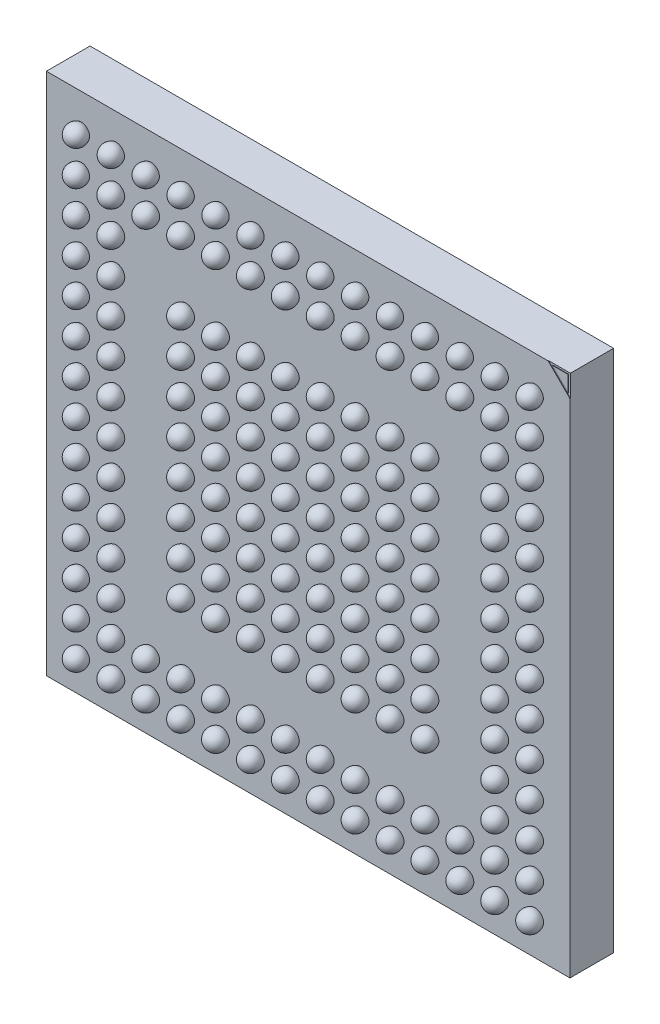
from build123d import *

# Parameters (mm, degrees)
SKETCH1_W            = 12
SKETCH1_H            = 12
BOSS_EXTRUDE1_DEPTH  = 1
LPATTERN1_COUNT      = 14
LPATTERN1_PITCH      = 0.8
LPATTERN2_COUNT      = 14
LPATTERN2_PITCH      = 0.8
LPATTERN3_COUNT      = 12
LPATTERN3_PITCH      = 0.8
LPATTERN4_COUNT      = 13
LPATTERN4_PITCH      = 0.8
LPATTERN5_COUNT      = 12
LPATTERN5_PITCH      = 0.8
LPATTERN6_COUNT      = 11
LPATTERN6_PITCH      = 0.8
LPATTERN7_COUNT      = 8
LPATTERN7_PITCH      = 0.8
LPATTERN7_COUNT_DIR2 = 8
LPATTERN7_PITCH_DIR2 = 0.8
BOSS_EXTRUDE2_DEPTH  = 0.01
BOSS_EXTRUDE3_DEPTH  = 0.01
CUT_EXTRUDE1_DEPTH   = 0.01
BOSS_EXTRUDE4_DEPTH  = 0.01


with BuildPart() as part:
    # Sketch1 → Boss-Extrude1 (new body)
    with BuildSketch(Plane.XY):
        Rectangle(SKETCH1_W, SKETCH1_H)
    extrude(amount=BOSS_EXTRUDE1_DEPTH)

    # Sketch3 → Revolve1 (revolve)
    with BuildSketch(Plane.XY.offset(1.12)):
        with BuildLine():
            Line((-5.2, 5.425), (-5.2, 4.975))
            ThreePointArc((-5.2, 4.975), (-5.425, 5.2), (-5.2, 5.425))
        make_face()
    revolve1 = revolve(axis=Axis((-5.2, 5.425, 1.12), (0, -1, 0)))

    # LPattern1: Revolve1 ×14
    with Locations(*[(i * LPATTERN1_PITCH, 0, 0) for i in range(1, LPATTERN1_COUNT)]):
        add(revolve1)

    # LPattern2: Revolve1 ×14
    with Locations(*[(0, -i * LPATTERN2_PITCH, 0) for i in range(1, LPATTERN2_COUNT)]):
        add(revolve1)

    # Sketch5 → Revolve2 (revolve)
    with BuildSketch(Plane.XY.offset(1.12)):
        with BuildLine():
            Line((5.2, 4.63), (5.2, 4.17))
            ThreePointArc((5.2, 4.17), (4.97, 4.4), (5.2, 4.63))
        make_face()
    revolve2 = revolve(axis=Axis((5.2, 5.2, 1.12), (0, -1, 0)))

    # LPattern3: Revolve2 ×12
    with Locations(*[(0, -i * LPATTERN3_PITCH, 0) for i in range(1, LPATTERN3_COUNT)]):
        add(revolve2)

    # Sketch8 → Revolve3 (revolve)
    with BuildSketch(Plane.XY.offset(1.12)):
        with BuildLine():
            Line((5.2, -4.972556486), (5.2, -5.432556486))
            ThreePointArc((5.2, -5.432556486), (5.43, -5.202556486), (5.2, -4.972556486))
        make_face()
    revolve3 = revolve(axis=Axis((5.2, -4.972556486, 1.12), (0, -1, 0)))

    # LPattern4: Revolve3 ×13
    with Locations(*[(-i * LPATTERN4_PITCH, 0, 0) for i in range(1, LPATTERN4_COUNT)]):
        add(revolve3)

    # Sketch9 → Revolve4 (revolve)
    with BuildSketch(Plane.XY.offset(1.12)):
        with BuildLine():
            Line((-4.4, 4.63), (-4.4, 4.17))
            ThreePointArc((-4.4, 4.17), (-4.17, 4.4), (-4.4, 4.63))
        make_face()
    revolve4 = revolve(axis=Axis((-4.4, 4.63, 1.12), (0, -1, 0)))

    # LPattern5: Revolve4 ×12
    with Locations(*[(i * LPATTERN5_PITCH, 0, 0) for i in range(1, LPATTERN5_COUNT)]):
        add(revolve4)

    # Mirror3: Revolve4 across plane
    add(revolve4.mirror(Plane.ZX))

    # Mirror3 copy 1 sketch → Mirror3 copy 1 (revolve)
    with BuildSketch(Plane(origin=(0.8, 0, 1.12), x_dir=(1, 0, 0), z_dir=(0, 0, 1))):
        with BuildLine():
            Line((-4.4, -4.63), (-4.4, -4.17))
            ThreePointArc((-4.4, -4.17), (-4.17, -4.4), (-4.4, -4.63))
        make_face()
    revolve(axis=Axis((-3.6, -4.63, 1.12), (0, -1, 0)))

    # Mirror3 copy 2 sketch → Mirror3 copy 2 (revolve)
    with BuildSketch(Plane(origin=(1.6, 0, 1.12), x_dir=(1, 0, 0), z_dir=(0, 0, 1))):
        with BuildLine():
            Line((-4.4, -4.63), (-4.4, -4.17))
            ThreePointArc((-4.4, -4.17), (-4.17, -4.4), (-4.4, -4.63))
        make_face()
    revolve(axis=Axis((-2.8, -4.63, 1.12), (0, -1, 0)))

    # Mirror3 copy 3 sketch → Mirror3 copy 3 (revolve)
    with BuildSketch(Plane(origin=(2.4, 0, 1.12), x_dir=(1, 0, 0), z_dir=(0, 0, 1))):
        with BuildLine():
            Line((-4.4, -4.63), (-4.4, -4.17))
            ThreePointArc((-4.4, -4.17), (-4.17, -4.4), (-4.4, -4.63))
        make_face()
    revolve(axis=Axis((-2, -4.63, 1.12), (0, -1, 0)))

    # Mirror3 copy 4 sketch → Mirror3 copy 4 (revolve)
    with BuildSketch(Plane(origin=(3.2, 0, 1.12), x_dir=(1, 0, 0), z_dir=(0, 0, 1))):
        with BuildLine():
            Line((-4.4, -4.63), (-4.4, -4.17))
            ThreePointArc((-4.4, -4.17), (-4.17, -4.4), (-4.4, -4.63))
        make_face()
    revolve(axis=Axis((-1.2, -4.63, 1.12), (0, -1, 0)))

    # Mirror3 copy 5 sketch → Mirror3 copy 5 (revolve)
    with BuildSketch(Plane(origin=(4, 0, 1.12), x_dir=(1, 0, 0), z_dir=(0, 0, 1))):
        with BuildLine():
            Line((-4.4, -4.63), (-4.4, -4.17))
            ThreePointArc((-4.4, -4.17), (-4.17, -4.4), (-4.4, -4.63))
        make_face()
    revolve(axis=Axis((-0.4, -4.63, 1.12), (0, -1, 0)))

    # Mirror3 copy 6 sketch → Mirror3 copy 6 (revolve)
    with BuildSketch(Plane(origin=(4.8, 0, 1.12), x_dir=(1, 0, 0), z_dir=(0, 0, 1))):
        with BuildLine():
            Line((-4.4, -4.63), (-4.4, -4.17))
            ThreePointArc((-4.4, -4.17), (-4.17, -4.4), (-4.4, -4.63))
        make_face()
    revolve(axis=Axis((0.4, -4.63, 1.12), (0, -1, 0)))

    # Mirror3 copy 7 sketch → Mirror3 copy 7 (revolve)
    with BuildSketch(Plane(origin=(5.6, 0, 1.12), x_dir=(1, 0, 0), z_dir=(0, 0, 1))):
        with BuildLine():
            Line((-4.4, -4.63), (-4.4, -4.17))
            ThreePointArc((-4.4, -4.17), (-4.17, -4.4), (-4.4, -4.63))
        make_face()
    revolve(axis=Axis((1.2, -4.63, 1.12), (0, -1, 0)))

    # Mirror3 copy 8 sketch → Mirror3 copy 8 (revolve)
    with BuildSketch(Plane(origin=(6.4, 0, 1.12), x_dir=(1, 0, 0), z_dir=(0, 0, 1))):
        with BuildLine():
            Line((-4.4, -4.63), (-4.4, -4.17))
            ThreePointArc((-4.4, -4.17), (-4.17, -4.4), (-4.4, -4.63))
        make_face()
    revolve(axis=Axis((2, -4.63, 1.12), (0, -1, 0)))

    # Mirror3 copy 9 sketch → Mirror3 copy 9 (revolve)
    with BuildSketch(Plane(origin=(7.2, 0, 1.12), x_dir=(1, 0, 0), z_dir=(0, 0, 1))):
        with BuildLine():
            Line((-4.4, -4.63), (-4.4, -4.17))
            ThreePointArc((-4.4, -4.17), (-4.17, -4.4), (-4.4, -4.63))
        make_face()
    revolve(axis=Axis((2.8, -4.63, 1.12), (0, -1, 0)))

    # Mirror3 copy 10 sketch → Mirror3 copy 10 (revolve)
    with BuildSketch(Plane(origin=(8, 0, 1.12), x_dir=(1, 0, 0), z_dir=(0, 0, 1))):
        with BuildLine():
            Line((-4.4, -4.63), (-4.4, -4.17))
            ThreePointArc((-4.4, -4.17), (-4.17, -4.4), (-4.4, -4.63))
        make_face()
    revolve(axis=Axis((3.6, -4.63, 1.12), (0, -1, 0)))

    # Mirror3 copy 11 sketch → Mirror3 copy 11 (revolve)
    with BuildSketch(Plane(origin=(8.8, 0, 1.12), x_dir=(1, 0, 0), z_dir=(0, 0, 1))):
        with BuildLine():
            Line((-4.4, -4.63), (-4.4, -4.17))
            ThreePointArc((-4.4, -4.17), (-4.17, -4.4), (-4.4, -4.63))
        make_face()
    revolve(axis=Axis((4.4, -4.63, 1.12), (0, -1, 0)))

    # LPattern6: Revolve4 ×11
    with Locations(*[(0, -i * LPATTERN6_PITCH, 0) for i in range(1, LPATTERN6_COUNT)]):
        add(revolve4)

    # Mirror4 copy 1 sketch → Mirror4 copy 1 (revolve)
    with BuildSketch(Plane(origin=(0, -0.8, 1.12), x_dir=(-1, 0, 0), z_dir=(0, 0, 1))):
        with BuildLine():
            Line((-4.4, -4.63), (-4.4, -4.17))
            ThreePointArc((-4.4, -4.17), (-4.17, -4.4), (-4.4, -4.63))
        make_face()
    revolve(axis=Axis((4.4, 3.83, 1.12), (0, 1, 0)))

    # Mirror4 copy 2 sketch → Mirror4 copy 2 (revolve)
    with BuildSketch(Plane(origin=(0, -1.6, 1.12), x_dir=(-1, 0, 0), z_dir=(0, 0, 1))):
        with BuildLine():
            Line((-4.4, -4.63), (-4.4, -4.17))
            ThreePointArc((-4.4, -4.17), (-4.17, -4.4), (-4.4, -4.63))
        make_face()
    revolve(axis=Axis((4.4, 3.03, 1.12), (0, 1, 0)))

    # Mirror4 copy 3 sketch → Mirror4 copy 3 (revolve)
    with BuildSketch(Plane(origin=(0, -2.4, 1.12), x_dir=(-1, 0, 0), z_dir=(0, 0, 1))):
        with BuildLine():
            Line((-4.4, -4.63), (-4.4, -4.17))
            ThreePointArc((-4.4, -4.17), (-4.17, -4.4), (-4.4, -4.63))
        make_face()
    revolve(axis=Axis((4.4, 2.23, 1.12), (0, 1, 0)))

    # Mirror4 copy 4 sketch → Mirror4 copy 4 (revolve)
    with BuildSketch(Plane(origin=(0, -3.2, 1.12), x_dir=(-1, 0, 0), z_dir=(0, 0, 1))):
        with BuildLine():
            Line((-4.4, -4.63), (-4.4, -4.17))
            ThreePointArc((-4.4, -4.17), (-4.17, -4.4), (-4.4, -4.63))
        make_face()
    revolve(axis=Axis((4.4, 1.43, 1.12), (0, 1, 0)))

    # Mirror4 copy 5 sketch → Mirror4 copy 5 (revolve)
    with BuildSketch(Plane(origin=(0, -4, 1.12), x_dir=(-1, 0, 0), z_dir=(0, 0, 1))):
        with BuildLine():
            Line((-4.4, -4.63), (-4.4, -4.17))
            ThreePointArc((-4.4, -4.17), (-4.17, -4.4), (-4.4, -4.63))
        make_face()
    revolve(axis=Axis((4.4, 0.63, 1.12), (0, 1, 0)))

    # Mirror4 copy 6 sketch → Mirror4 copy 6 (revolve)
    with BuildSketch(Plane(origin=(0, -4.8, 1.12), x_dir=(-1, 0, 0), z_dir=(0, 0, 1))):
        with BuildLine():
            Line((-4.4, -4.63), (-4.4, -4.17))
            ThreePointArc((-4.4, -4.17), (-4.17, -4.4), (-4.4, -4.63))
        make_face()
    revolve(axis=Axis((4.4, -0.17, 1.12), (0, 1, 0)))

    # Mirror4 copy 7 sketch → Mirror4 copy 7 (revolve)
    with BuildSketch(Plane(origin=(0, -5.6, 1.12), x_dir=(-1, 0, 0), z_dir=(0, 0, 1))):
        with BuildLine():
            Line((-4.4, -4.63), (-4.4, -4.17))
            ThreePointArc((-4.4, -4.17), (-4.17, -4.4), (-4.4, -4.63))
        make_face()
    revolve(axis=Axis((4.4, -0.97, 1.12), (0, 1, 0)))

    # Mirror4 copy 8 sketch → Mirror4 copy 8 (revolve)
    with BuildSketch(Plane(origin=(0, -6.4, 1.12), x_dir=(-1, 0, 0), z_dir=(0, 0, 1))):
        with BuildLine():
            Line((-4.4, -4.63), (-4.4, -4.17))
            ThreePointArc((-4.4, -4.17), (-4.17, -4.4), (-4.4, -4.63))
        make_face()
    revolve(axis=Axis((4.4, -1.77, 1.12), (0, 1, 0)))

    # Mirror4 copy 9 sketch → Mirror4 copy 9 (revolve)
    with BuildSketch(Plane(origin=(0, -7.2, 1.12), x_dir=(-1, 0, 0), z_dir=(0, 0, 1))):
        with BuildLine():
            Line((-4.4, -4.63), (-4.4, -4.17))
            ThreePointArc((-4.4, -4.17), (-4.17, -4.4), (-4.4, -4.63))
        make_face()
    revolve(axis=Axis((4.4, -2.57, 1.12), (0, 1, 0)))

    # Mirror4 copy 10 sketch → Mirror4 copy 10 (revolve)
    with BuildSketch(Plane(origin=(0, -8, 1.12), x_dir=(-1, 0, 0), z_dir=(0, 0, 1))):
        with BuildLine():
            Line((-4.4, -4.63), (-4.4, -4.17))
            ThreePointArc((-4.4, -4.17), (-4.17, -4.4), (-4.4, -4.63))
        make_face()
    revolve(axis=Axis((4.4, -3.37, 1.12), (0, 1, 0)))

    # Mirror4 copy 11 sketch → Mirror4 copy 11 (revolve)
    with BuildSketch(Plane(origin=(0, 0, 1.12), x_dir=(-1, 0, 0), z_dir=(0, 0, 1))):
        with BuildLine():
            Line((-4.4, -4.63), (-4.4, -4.17))
            ThreePointArc((-4.4, -4.17), (-4.17, -4.4), (-4.4, -4.63))
        make_face()
    revolve(axis=Axis((4.4, 4.63, 1.12), (0, 1, 0)))

    # Sketch10 → Revolve5 (revolve)
    with BuildSketch(Plane.XY.offset(1.12)):
        with BuildLine():
            Line((-2.8, 3.03), (-2.8, 2.57))
            ThreePointArc((-2.8, 2.57), (-3.03, 2.8), (-2.8, 3.03))
        make_face()
    revolve5 = revolve(axis=Axis((-2.8, 3.03, 1.12), (0, -1, 0)))

    # LPattern7: Revolve5 8 × 8
    with Locations(*[(i * LPATTERN7_PITCH, -j * LPATTERN7_PITCH_DIR2, 0) for i in range(LPATTERN7_COUNT) for j in range(LPATTERN7_COUNT_DIR2) if (i, j) != (0, 0)]):
        add(revolve5)

    # Sketch11 → Boss-Extrude2 (add)
    # profile 1 of 2: a face of its own
    with BuildSketch(Plane(origin=(0, 0, 0), x_dir=(-1, 0, 0), z_dir=(0, 0, -1))):
        with BuildLine():
            Line((-4.383850212, 0.87976633), (-4.383850212, 4.310264847))
            Line((-4.383850212, 4.310264847), (-3.29335538, 4.310264847))
            Line((-3.29335538, 4.310264847), (-1.699193609, 2.507481058))
            Line((-1.699193609, 2.507481058), (-1.699193609, 4.310264847))
            Line((-1.699193609, 4.310264847), (-0.340536036, 4.310264847))
            Line((-0.340536036, 4.310264847), (0.283707933, 3.303879896))
            Line((0.283707933, 3.303879896), (0.905288203, 4.310264847))
            Line((0.905288203, 4.310264847), (3.996249009, 4.310264847))
            ThreePointArc((3.996249009, 4.310264847), (4.420513078, 4.134528915), (4.596249009, 3.710264847))
            Line((4.596249009, 3.710264847), (4.596249009, 2.778053424))
            ThreePointArc((4.596249009, 2.778053424), (4.420513078, 2.353789355), (3.996249009, 2.178053424))
            Line((3.996249009, 2.178053424), (2.328850088, 2.178053424))
            Line((2.328850088, 2.178053424), (2.328850088, 0.844626446))
            Line((2.328850088, 0.844626446), (0.905288203, 0.844626446))
            Line((0.905288203, 0.844626446), (0.283707933, 1.846717072))
            Line((0.283707933, 1.846717072), (-0.324294808, 0.862315154))
            Line((-0.324294808, 0.862315154), (-1.585887652, 0.862315154))
            Line((-1.585887652, 0.862315154), (-3.219751476, 2.709996656))
            Line((-3.219751476, 2.709996656), (-3.219751476, 0.87976633))
            Line((-3.219751476, 0.87976633), (-4.383850212, 0.87976633))
        make_face()
        Polygon((-4.219704391, 1.045144765), (-4.219704391, 4.114773531), (-3.322697893, 4.114773531), (-1.495738313, 1.992381752), (-1.495738313, 3.900233946), (-0.680566666, 2.594058204), (-1.59427424, 1.073528346), (-3.375117038, 3.142345934), (-3.375117038, 1.045144765), align=None, mode=Mode.SUBTRACT)
        Polygon((-1.445224228, 4.150363705), (-0.430793897, 4.150363705), (0.294524128, 2.989356236), (0.990555559, 4.150363705), (2.003154175, 4.150363705), (1.060414542, 2.577837373), (2.035310731, 1.017333266), (1.029352181, 1.017333266), (0.294524128, 2.193563318), (-0.404596433, 1.027403062), (-1.445224228, 1.027403062), (-0.458796817, 2.594058204), align=None, mode=Mode.SUBTRACT)
        with BuildLine():
            Line((2.21981642, 4.150363705), (3.859234326, 4.127386313))
            ThreePointArc((3.859234326, 4.127386313), (4.280993931, 3.945721917), (4.450766882, 3.519036714))
            Line((4.450766882, 3.519036714), (4.442189322, 2.907034951))
            ThreePointArc((4.442189322, 2.907034951), (4.263528963, 2.488216886), (3.842248245, 2.315443472))
            Line((3.842248245, 2.315443472), (2.152608039, 2.315443472))
            Line((2.152608039, 2.315443472), (2.152608039, 1.109618447))
            Line((2.152608039, 1.109618447), (1.267354651, 2.577837373))
            Line((1.267354651, 2.577837373), (2.21981642, 4.150363705))
        make_face(mode=Mode.SUBTRACT)
    # profile 2 of 2: a face of its own
    with BuildSketch(Plane(origin=(0, 0, 0), x_dir=(-1, 0, 0), z_dir=(0, 0, -1))):
        with BuildLine():
            Line((2.152608039, 3.693985443), (3.707065203, 3.693985443))
            ThreePointArc((3.707065203, 3.693985443), (3.848486559, 3.635406799), (3.907065203, 3.493985443))
            Line((3.907065203, 3.493985443), (3.907065203, 2.978053424))
            ThreePointArc((3.907065203, 2.978053424), (3.848486559, 2.836632068), (3.707065203, 2.778053424))
            Line((3.707065203, 2.778053424), (2.152608039, 2.778053424))
            Line((2.152608039, 2.778053424), (2.152608039, 3.693985443))
        make_face()
        with BuildLine():
            Line((2.313280362, 3.527993081), (3.520235623, 3.527993081))
            ThreePointArc((3.520235623, 3.527993081), (3.661656979, 3.469414438), (3.720235623, 3.327993081))
            Line((3.720235623, 3.327993081), (3.720235623, 3.154921786))
            ThreePointArc((3.720235623, 3.154921786), (3.661656979, 3.01350043), (3.520235623, 2.954921786))
            Line((3.520235623, 2.954921786), (2.313280362, 2.954921786))
            Line((2.313280362, 2.954921786), (2.313280362, 3.527993081))
        make_face(mode=Mode.SUBTRACT)
    extrude(amount=BOSS_EXTRUDE2_DEPTH)

    # Sketch12 → Boss-Extrude3 (add)
    # profile 1 of 7: a face of its own
    with BuildSketch(Plane(origin=(0, 0, 0), x_dir=(-1, 0, 0), z_dir=(0, 0, -1))):
        with BuildLine():
            Line((-2.389935631, -3.291769219), (-2.550993323, -3.439124989))
            add(Edge.make_bspline(
                [(-2.550993323, -3.439124989), (-2.557892344, -3.429393202), (-2.571137502, -3.41070953), (-2.592606522, -3.385691652), (-2.613978598, -3.36434954), (-2.63545173, -3.346772353), (-2.657216247, -3.333066883), (-2.679234369, -3.323363259), (-2.70138127, -3.317194573), (-2.716260569, -3.316426423), (-2.723589477, -3.316048066)],
                knots=[0, 0, 0, 0, 1.299362458, 2.494594718, 3.587462134, 4.587049575, 5.512617175, 6.380583204, 7.202344345, 8, 8, 8, 8], degree=3))
            add(Edge.make_bspline(
                [(-2.723589477, -3.316048066), (-2.730425672, -3.31628781), (-2.743624569, -3.316750695), (-2.762440575, -3.321351731), (-2.779145694, -3.329292444), (-2.793723621, -3.339675594), (-2.80527149, -3.352184882), (-2.814491568, -3.36530391), (-2.819683247, -3.379784349), (-2.820366574, -3.389730099), (-2.820704861, -3.394653835)],
                knots=[0, 0, 0, 0, 1.185010067, 2.2879431, 3.333075148, 4.379039566, 5.372662701, 6.27520591, 7.14612461, 8, 8, 8, 8], degree=3))
            add(Edge.make_bspline(
                [(-2.820704861, -3.394653835), (-2.820492874, -3.399648573), (-2.82006596, -3.409707283), (-2.815942557, -3.424449574), (-2.80972741, -3.438854509), (-2.803788584, -3.447623478), (-2.800752938, -3.452105758)],
                knots=[0, 0, 0, 0, 0.967525499, 1.948461899, 2.951351359, 4, 4, 4, 4], degree=3))
            add(Edge.make_bspline(
                [(-2.800752938, -3.452105758), (-2.797993208, -3.455589787), (-2.791640674, -3.463609562), (-2.779527693, -3.476311635), (-2.764316332, -3.491872787), (-2.745421227, -3.509757915), (-2.723626765, -3.530610238), (-2.697922745, -3.553610043), (-2.66904904, -3.579469608), (-2.64852628, -3.597477272), (-2.637772169, -3.60691345)],
                knots=[0, 0, 0, 0, 0.473873513, 1.090794244, 1.870441696, 2.795289791, 3.865433203, 5.087734844, 6.473946851, 8, 8, 8, 8], degree=3))
            add(Edge.make_bspline(
                [(-2.637772169, -3.60691345), (-2.627677889, -3.61564954), (-2.608521042, -3.632228825), (-2.581264654, -3.655760457), (-2.557310828, -3.676931293), (-2.536310612, -3.695423603), (-2.518582349, -3.711431415), (-2.504051508, -3.725031245), (-2.492540622, -3.73595833), (-2.485997356, -3.742558295), (-2.483204861, -3.745374989)],
                knots=[0, 0, 0, 0, 1.543621617, 2.929473131, 4.163658386, 5.240097082, 6.164993805, 6.925417477, 7.541396219, 8, 8, 8, 8], degree=3))
            add(Edge.make_bspline(
                [(-2.483204861, -3.745374989), (-2.472610718, -3.756840121), (-2.452245054, -3.778880131), (-2.425776871, -3.813035214), (-2.4039927, -3.846377541), (-2.387140052, -3.879534499), (-2.374412254, -3.912984479), (-2.365438988, -3.947547839), (-2.360064839, -3.983585745), (-2.359468183, -4.008177216), (-2.3591664, -4.020615373)],
                knots=[0, 0, 0, 0, 1.206664779, 2.319633467, 3.337109185, 4.282041471, 5.190008762, 6.099243693, 7.03861361, 8, 8, 8, 8], degree=3))
            add(Edge.make_bspline(
                [(-2.3591664, -4.020615373), (-2.359381202, -4.032734832), (-2.359802651, -4.056513661), (-2.364964594, -4.091310436), (-2.372325222, -4.124612459), (-2.383706044, -4.156057358), (-2.397576923, -4.186161292), (-2.414966073, -4.214455336), (-2.435387245, -4.241225838), (-2.458793044, -4.265994243), (-2.484682636, -4.288469853), (-2.512451685, -4.308478172), (-2.542371729, -4.324997588), (-2.574187137, -4.338600149), (-2.607880878, -4.349077024), (-2.643412814, -4.35682041), (-2.680837292, -4.361467869), (-2.706428689, -4.361953705), (-2.719502938, -4.362201912)],
                knots=[0, 0, 0, 0, 1.043214005, 2.046824704, 3.02475056, 3.976699089, 4.921714032, 5.875962561, 6.831408892, 7.817874052, 8.806269674, 9.781291748, 10.760897367, 11.74438705, 12.757449933, 13.795994037, 14.874007457, 16, 16, 16, 16], degree=3))
            add(Edge.make_bspline(
                [(-2.719502938, -4.362201912), (-2.729766112, -4.362019836), (-2.750093083, -4.361659222), (-2.780051965, -4.358715109), (-2.808980652, -4.353963624), (-2.836846558, -4.347153326), (-2.863775225, -4.338523754), (-2.889767759, -4.327983064), (-2.914644724, -4.315367877), (-2.938594351, -4.300937612), (-2.961500215, -4.284182174), (-2.983651953, -4.265444122), (-3.004829532, -4.244435257), (-3.025134663, -4.221205263), (-3.044437429, -4.195688359), (-3.063369679, -4.168239914), (-3.081090006, -4.138350524), (-3.092036641, -4.117382875), (-3.097627938, -4.106673066)],
                knots=[0, 0, 0, 0, 1.016823716, 2.013894106, 2.979844003, 3.91962641, 4.853723003, 5.779685073, 6.695824784, 7.614987388, 8.547259901, 9.504950863, 10.487499108, 11.500346958, 12.559593716, 13.656357062, 14.802919212, 16, 16, 16, 16], degree=3))
            Line((-3.097627938, -4.106673066), (-2.908204861, -3.992971142))
            add(Edge.make_bspline(
                [(-2.908204861, -3.992971142), (-2.901210984, -4.005128176), (-2.887803122, -4.028434248), (-2.865082247, -4.059748909), (-2.84180587, -4.086564733), (-2.817435863, -4.108407748), (-2.792268555, -4.125570024), (-2.766182384, -4.137835376), (-2.73915902, -4.145427616), (-2.720751932, -4.146354803), (-2.711570246, -4.146817296)],
                knots=[0, 0, 0, 0, 1.283663364, 2.460892379, 3.537111102, 4.529833553, 5.449777664, 6.316464042, 7.160231139, 8, 8, 8, 8], degree=3))
            add(Edge.make_bspline(
                [(-2.711570246, -4.146817296), (-2.702231157, -4.1464396), (-2.684111963, -4.145706813), (-2.658249132, -4.138938282), (-2.63453711, -4.128311193), (-2.614040613, -4.113147802), (-2.596685472, -4.095646944), (-2.583876382, -4.076176439), (-2.575829625, -4.055109823), (-2.574978887, -4.040475566), (-2.574551015, -4.033115373)],
                knots=[0, 0, 0, 0, 1.13588714, 2.203786484, 3.234766741, 4.283437687, 5.291419208, 6.222934724, 7.106237994, 8, 8, 8, 8], degree=3))
            add(Edge.make_bspline(
                [(-2.574551015, -4.033115373), (-2.574946138, -4.026267912), (-2.575748791, -4.012357949), (-2.581660888, -3.991676071), (-2.590903299, -3.971003598), (-2.601837722, -3.954047477), (-2.612964867, -3.939850576), (-2.623604928, -3.927549604), (-2.636561707, -3.913959183), (-2.651802352, -3.899062218), (-2.669125494, -3.882727567), (-2.688545726, -3.86495683), (-2.710285429, -3.845906545), (-2.725651095, -3.832929679), (-2.733685631, -3.826144219)],
                knots=[0, 0, 0, 0, 0.916159276, 1.861089862, 2.860218735, 3.940849679, 4.552606315, 5.27541173, 6.11797699, 7.06649574, 8.129236253, 9.306560635, 10.591630461, 12, 12, 12, 12], degree=3))
            add(Edge.make_bspline(
                [(-2.733685631, -3.826144219), (-2.748959603, -3.813220974), (-2.778274979, -3.788417355), (-2.819701325, -3.751783189), (-2.857030172, -3.717545205), (-2.889939108, -3.685280146), (-2.918847444, -3.655583872), (-2.9435594, -3.62821518), (-2.963803503, -3.602962956), (-2.985106057, -3.573053387), (-3.005347743, -3.536606523), (-3.022842303, -3.492756719), (-3.034192035, -3.448912479), (-3.035463615, -3.419477872), (-3.036089477, -3.404990373)],
                knots=[0, 0, 0, 0, 1.345494975, 2.582412109, 3.71882943, 4.751509156, 5.681369928, 6.505683931, 7.230279997, 7.856715994, 8.973648664, 10.023341002, 11.027102913, 12, 12, 12, 12], degree=3))
            add(Edge.make_bspline(
                [(-3.036089477, -3.404990373), (-3.035829182, -3.394716617), (-3.035316372, -3.374476214), (-3.030742031, -3.34471565), (-3.023905505, -3.315999206), (-3.013976905, -3.288431653), (-3.001090782, -3.262047521), (-2.985441086, -3.236717647), (-2.966784807, -3.212675164), (-2.94576044, -3.189936008), (-2.922596971, -3.169155007), (-2.89784386, -3.150813692), (-2.871641213, -3.13532235), (-2.844149324, -3.122471157), (-2.815197836, -3.112634385), (-2.785000036, -3.105661591), (-2.753512609, -3.101514396), (-2.73209554, -3.100950633), (-2.721185631, -3.10066345)],
                knots=[0, 0, 0, 0, 1.010766082, 1.991317756, 2.957454644, 3.913069143, 4.869106762, 5.843196583, 6.838735724, 7.860187025, 8.887984031, 9.89767229, 10.887916223, 11.879572884, 12.879850636, 13.892031539, 14.926195476, 16, 16, 16, 16], degree=3))
            add(Edge.make_bspline(
                [(-2.721185631, -3.10066345), (-2.707046928, -3.101180674), (-2.678881129, -3.102211039), (-2.637237182, -3.110268156), (-2.596561116, -3.122938822), (-2.56378358, -3.138224585), (-2.537703107, -3.153031912), (-2.51771486, -3.166664633), (-2.497375743, -3.182281648), (-2.476521733, -3.19993217), (-2.45554033, -3.219948758), (-2.433834934, -3.241854901), (-2.411701305, -3.26583992), (-2.397317956, -3.282974706), (-2.389935631, -3.291769219)],
                knots=[0, 0, 0, 0, 1.282922637, 2.555718331, 3.837320111, 5.142675274, 5.830281639, 6.55870424, 7.337177975, 8.157850921, 9.037902056, 9.96903443, 10.957596896, 12, 12, 12, 12], degree=3))
        make_face()
    # profile 2 of 7: a face of its own
    with BuildSketch(Plane(origin=(0, 0, 0), x_dir=(-1, 0, 0), z_dir=(0, 0, -1))):
        with BuildLine():
            Line((-1.836089477, -3.131432681), (-1.620704861, -3.131432681))
            Line((-1.620704861, -3.131432681), (-1.620704861, -3.928067296))
            add(Edge.make_bspline(
                [(-1.620704861, -3.928067296), (-1.620783828, -3.943293138), (-1.620935981, -3.972630329), (-1.6224593, -4.014865055), (-1.624519096, -4.053587995), (-1.627485402, -4.088737103), (-1.631891177, -4.12031068), (-1.636877178, -4.148387498), (-1.64237812, -4.173081962), (-1.651670561, -4.20071891), (-1.666096807, -4.231323686), (-1.687866424, -4.264381193), (-1.714976565, -4.293102533), (-1.746198493, -4.318050337), (-1.781795275, -4.337804279), (-1.820946846, -4.352082481), (-1.863528046, -4.360612377), (-1.893020882, -4.361661688), (-1.908204861, -4.362201912)],
                knots=[0, 0, 0, 0, 1.22248561, 2.355488409, 3.392943897, 4.335991845, 5.186735882, 5.951517034, 6.625683685, 7.215700098, 8.28923535, 9.333114649, 10.380102123, 11.447198135, 12.530158036, 13.633358744, 14.781567393, 16, 16, 16, 16], degree=3))
            add(Edge.make_bspline(
                [(-1.908204861, -4.362201912), (-1.924025187, -4.361712133), (-1.955229045, -4.360746097), (-2.000992718, -4.352517955), (-2.044977328, -4.339325767), (-2.086955323, -4.320251447), (-2.127501813, -4.296358283), (-2.165880917, -4.26672114), (-2.202893937, -4.232259194), (-2.224835482, -4.205813961), (-2.236089477, -4.192249989)],
                knots=[0, 0, 0, 0, 0.990984786, 1.954608977, 2.90473533, 3.862451285, 4.837525908, 5.848096122, 6.896271184, 8, 8, 8, 8], degree=3))
            Line((-2.236089477, -4.192249989), (-2.073108708, -4.041528835))
            add(Edge.make_bspline(
                [(-2.073108708, -4.041528835), (-2.064575219, -4.051177801), (-2.048606766, -4.069233611), (-2.024542779, -4.092778831), (-2.002835767, -4.111694697), (-1.982373239, -4.125338882), (-1.963063242, -4.134956509), (-1.944490308, -4.141884356), (-1.926075493, -4.145805911), (-1.913910104, -4.146485271), (-1.907964477, -4.146817296)],
                knots=[0, 0, 0, 0, 1.529509877, 2.862124173, 3.996688592, 4.944357383, 5.774364335, 6.554177287, 7.293378699, 8, 8, 8, 8], degree=3))
            add(Edge.make_bspline(
                [(-1.907964477, -4.146817296), (-1.902209772, -4.146517198), (-1.891145365, -4.145940207), (-1.875931382, -4.139526221), (-1.863105015, -4.129455993), (-1.854660892, -4.117878959), (-1.849279751, -4.106044114), (-1.845917513, -4.094603917), (-1.842726743, -4.080890222), (-1.840170369, -4.064909901), (-1.838238769, -4.046454513), (-1.837276005, -4.025748106), (-1.836105162, -4.002678785), (-1.836094891, -3.986562862), (-1.836089477, -3.978067296)],
                knots=[0, 0, 0, 0, 1.003927327, 1.930222208, 2.840933547, 3.835773585, 4.407906147, 5.114514582, 5.922289074, 6.876303333, 7.950072246, 9.174518422, 10.510537432, 12, 12, 12, 12], degree=3))
            Line((-1.836089477, -3.978067296), (-1.836089477, -3.131432681))
        make_face()
    # profile 3 of 7: a face of its own
    with BuildSketch(Plane(origin=(0, 0, 0), x_dir=(-1, 0, 0), z_dir=(0, 0, -1))):
        Polygon((-0.974310631, -3.131432681), (-0.774551015, -3.131432681), (-0.289935631, -4.331432681), (-0.519983708, -4.331432681), (-0.613252938, -4.085278835), (-1.136089477, -4.085278835), (-1.229358708, -4.331432681), (-1.4591664, -4.331432681), align=None)
        Polygon((-0.874551015, -3.453307681), (-1.054358708, -3.869894219), (-0.694743323, -3.869894219), align=None, mode=Mode.SUBTRACT)
    # profile 4 of 7: a face of its own
    with BuildSketch(Plane(origin=(0, 0, 0), x_dir=(-1, 0, 0), z_dir=(0, 0, -1))):
        Polygon((0.015593215, -3.131432681), (0.348525908, -3.131432681), (0.348525908, -4.331432681), (0.133141292, -4.331432681), (0.133141292, -3.331432681), (-0.113012554, -3.331432681), align=None)
    # profile 5 of 7: a face of its own
    with BuildSketch(Plane(origin=(0, 0, 0), x_dir=(-1, 0, 0), z_dir=(0, 0, -1))):
        Polygon((0.938670139, -3.131432681), (1.271602831, -3.131432681), (1.271602831, -4.331432681), (1.056218215, -4.331432681), (1.056218215, -3.331432681), (0.810064369, -3.331432681), align=None)
    # profile 6 of 7: a face of its own
    with BuildSketch(Plane(origin=(0, 0, 0), x_dir=(-1, 0, 0), z_dir=(0, 0, -1))):
        with BuildLine():
            add(Edge.make_bspline(
                [(2.044920139, -3.10066345), (2.055345648, -3.10081822), (2.075844985, -3.101122538), (2.106036649, -3.104418555), (2.13511957, -3.109397916), (2.163207522, -3.11634239), (2.190098326, -3.125533153), (2.215987699, -3.136534338), (2.240567482, -3.149922982), (2.264151147, -3.165046142), (2.286729608, -3.182167704), (2.307760208, -3.201687168), (2.327627011, -3.223155391), (2.345899973, -3.246896934), (2.362983755, -3.272695842), (2.378822222, -3.300556207), (2.393294128, -3.330614386), (2.406561666, -3.362924621), (2.418425541, -3.39797123), (2.428418469, -3.436156211), (2.436989076, -3.477488286), (2.444223273, -3.522070335), (2.449691157, -3.569961619), (2.453376621, -3.621130322), (2.45590576, -3.675477797), (2.456112171, -3.712759719), (2.456218215, -3.73191345)],
                knots=[0, 0, 0, 0, 0.879237366, 1.728815576, 2.559023295, 3.367336655, 4.166867292, 4.954216142, 5.737608147, 6.525189134, 7.316157332, 8.124696809, 8.942788509, 9.781158001, 10.649253743, 11.551476218, 12.482711956, 13.461909668, 14.496590415, 15.601789533, 16.789733467, 18.056700938, 19.410929216, 20.8549011, 22.384193279, 24, 24, 24, 24], degree=3))
            add(Edge.make_bspline(
                [(2.456218215, -3.73191345), (2.45610361, -3.751306816), (2.455880934, -3.788987779), (2.453481758, -3.843832344), (2.449350262, -3.895372562), (2.444025293, -3.943603101), (2.436731542, -3.988498491), (2.428189545, -4.030174982), (2.418038883, -4.068617466), (2.405784215, -4.103739324), (2.392596985, -4.136106303), (2.378085493, -4.166105876), (2.362502672, -4.193819297), (2.346205945, -4.219664662), (2.328301866, -4.242880062), (2.309661876, -4.264254942), (2.289474358, -4.282975106), (2.268589283, -4.300005307), (2.246241547, -4.314722818), (2.222661616, -4.32759451), (2.197429102, -4.338034981), (2.171003949, -4.347115545), (2.142935736, -4.353634411), (2.113670463, -4.358806916), (2.082877731, -4.36166556), (2.061912799, -4.362020194), (2.051170139, -4.362201912)],
                knots=[0, 0, 0, 0, 1.643780988, 3.193836972, 4.651895693, 6.025988579, 7.305620092, 8.505800249, 9.631074763, 10.672816429, 11.65661981, 12.592235626, 13.49536222, 14.350718032, 15.179365177, 15.97804903, 16.751647189, 17.51006938, 18.259804725, 19.016521909, 19.783502495, 20.571750527, 21.382245291, 22.22305063, 23.089471752, 24, 24, 24, 24], degree=3))
            add(Edge.make_bspline(
                [(2.051170139, -4.362201912), (2.040427768, -4.362016688), (2.019383623, -4.361653839), (1.988507624, -4.358828171), (1.95908726, -4.353613457), (1.930796983, -4.347065498), (1.903833688, -4.338055073), (1.878068087, -4.32730223), (1.853698296, -4.314510851), (1.830656839, -4.299759049), (1.809022385, -4.282842794), (1.788458735, -4.263943022), (1.769011378, -4.243107641), (1.750976155, -4.220103276), (1.734057703, -4.195236988), (1.718432453, -4.168224816), (1.704109796, -4.139106088), (1.690641717, -4.107840218), (1.678939661, -4.073754085), (1.668525375, -4.036543306), (1.659994265, -3.995897698), (1.653132976, -3.951830318), (1.647654927, -3.904434526), (1.643579888, -3.853687445), (1.641167385, -3.799565437), (1.640947045, -3.762364685), (1.6408336, -3.743211527)],
                knots=[0, 0, 0, 0, 0.917216111, 1.796812873, 2.643793957, 3.46689424, 4.273913431, 5.068098542, 5.848489301, 6.620921603, 7.401012384, 8.190319798, 9.003608147, 9.831726257, 10.68377682, 11.569763213, 12.493818149, 13.453288342, 14.474581811, 15.568529029, 16.750744269, 18.018426408, 19.375425659, 20.823733699, 22.36466933, 24, 24, 24, 24], degree=3))
            add(Edge.make_bspline(
                [(1.6408336, -3.743211527), (1.641039094, -3.716599722), (1.641435598, -3.665251901), (1.646460382, -3.591069229), (1.65383549, -3.522500199), (1.664667778, -3.45965951), (1.678061752, -3.402314419), (1.695213433, -3.350842684), (1.714739374, -3.30453208), (1.731377984, -3.2770974), (1.739391292, -3.263884604)],
                knots=[0, 0, 0, 0, 1.288568992, 2.486310467, 3.599230591, 4.627010532, 5.572937695, 6.447898582, 7.252493626, 8, 8, 8, 8], degree=3))
            add(Edge.make_bspline(
                [(1.739391292, -3.263884604), (1.748708786, -3.250904358), (1.766926321, -3.225525419), (1.798780191, -3.192207616), (1.833003026, -3.163712599), (1.870297745, -3.140685236), (1.910074516, -3.122525856), (1.952674843, -3.109700091), (1.99794141, -3.102227202), (2.029026717, -3.101192485), (2.044920139, -3.10066345)],
                knots=[0, 0, 0, 0, 1.058512271, 2.069600068, 3.047294572, 4.004278952, 4.967380941, 5.939006123, 6.946246673, 8, 8, 8, 8], degree=3))
        make_face()
        with BuildLine():
            add(Edge.make_bspline(
                [(2.0502086, -3.316048066), (2.040783853, -3.31649478), (2.022306346, -3.317370577), (1.995494603, -3.324804859), (1.970212804, -3.336287507), (1.950981614, -3.35010508), (1.93658726, -3.36335088), (1.926529822, -3.375337899), (1.916831008, -3.388714548), (1.908264526, -3.404084446), (1.900175532, -3.420895336), (1.892270146, -3.439223527), (1.885789806, -3.459519202), (1.879423043, -3.48143672), (1.873845165, -3.505582045), (1.869172126, -3.532152536), (1.864997176, -3.561320985), (1.862085099, -3.593106496), (1.859370169, -3.627475815), (1.857423979, -3.664505502), (1.856610326, -3.704185569), (1.85635169, -3.731512642), (1.856218215, -3.745615373)],
                knots=[0, 0, 0, 0, 1.076674018, 2.110852608, 3.161083442, 4.239746716, 4.804137807, 5.395870207, 6.026861976, 6.692161227, 7.405688833, 8.16177676, 8.973626916, 9.841385931, 10.773283133, 11.807421078, 12.927755683, 14.143907515, 15.458935494, 16.872852025, 18.386167141, 20, 20, 20, 20], degree=3))
            add(Edge.make_bspline(
                [(1.856218215, -3.745615373), (1.856437898, -3.763886144), (1.856859157, -3.798921701), (1.859065511, -3.849304051), (1.863487964, -3.895156047), (1.868988603, -3.936788445), (1.876714476, -3.973931246), (1.885603592, -4.006935857), (1.89658086, -4.035381548), (1.909267209, -4.059679709), (1.923317911, -4.080350105), (1.938570567, -4.097920033), (1.954505878, -4.113134763), (1.971621236, -4.1254935), (1.98987581, -4.134964667), (2.009117208, -4.14177716), (2.029357657, -4.145947371), (2.043218107, -4.146525645), (2.0502086, -4.146817296)],
                knots=[0, 0, 0, 0, 1.771748488, 3.397459088, 4.888034009, 6.237357457, 7.467047327, 8.564189669, 9.548206622, 10.417051504, 11.216568818, 11.965764335, 12.669334354, 13.348544111, 14.005342236, 14.656555988, 15.322436492, 16, 16, 16, 16], degree=3))
            add(Edge.make_bspline(
                [(2.0502086, -4.146817296), (2.056959201, -4.146617727), (2.070176039, -4.146226994), (2.089449148, -4.142216177), (2.10767517, -4.13569546), (2.124799074, -4.126471448), (2.14088211, -4.114741706), (2.155845674, -4.100454687), (2.169576914, -4.083467984), (2.177576797, -4.070861338), (2.181698985, -4.064365373)],
                knots=[0, 0, 0, 0, 0.992283464, 1.942767638, 2.88273346, 3.832339453, 4.79467288, 5.803907806, 6.868395428, 8, 8, 8, 8], degree=3))
            add(Edge.make_bspline(
                [(2.181698985, -4.064365373), (2.186552166, -4.055488845), (2.196728895, -4.036875484), (2.208505422, -4.005466132), (2.218418247, -3.970041574), (2.22695007, -3.930491566), (2.232785316, -3.886660117), (2.237810624, -3.838825167), (2.240234454, -3.786745838), (2.240628704, -3.750665091), (2.2408336, -3.73191345)],
                knots=[0, 0, 0, 0, 0.710965849, 1.490837728, 2.352621235, 3.297892224, 4.334225155, 5.461620853, 6.680770821, 8, 8, 8, 8], degree=3))
            add(Edge.make_bspline(
                [(2.2408336, -3.73191345), (2.240754453, -3.712999036), (2.240602108, -3.676592017), (2.237807025, -3.624325459), (2.233914657, -3.576588633), (2.228221248, -3.533488115), (2.220895641, -3.494919277), (2.211866803, -3.46088464), (2.201222475, -3.431317127), (2.188599571, -3.406246222), (2.17461892, -3.384939392), (2.159778032, -3.366659785), (2.144014154, -3.351053117), (2.127353648, -3.338060659), (2.109410901, -3.328133446), (2.090528643, -3.321124013), (2.070668164, -3.316883541), (2.057120505, -3.316330316), (2.0502086, -3.316048066)],
                knots=[0, 0, 0, 0, 1.793836731, 3.452829483, 4.963243077, 6.335886805, 7.574563692, 8.684454726, 9.672768357, 10.54971625, 11.340229787, 12.085688095, 12.778991901, 13.440269426, 14.083255152, 14.715733572, 15.344777694, 16, 16, 16, 16], degree=3))
        make_face(mode=Mode.SUBTRACT)
    # profile 7 of 7: a face of its own
    with BuildSketch(Plane(origin=(0, 0, 0), x_dir=(-1, 0, 0), z_dir=(0, 0, -1))):
        with BuildLine():
            Line((2.786747062, -3.131432681), (3.333141292, -3.131432681))
            Line((3.333141292, -3.131432681), (3.333141292, -3.331432681))
            Line((3.333141292, -3.331432681), (2.957420139, -3.331432681))
            Line((2.957420139, -3.331432681), (2.910545139, -3.558355758))
            add(Edge.make_bspline(
                [(2.910545139, -3.558355758), (2.916932528, -3.556576789), (2.929529773, -3.553068297), (2.948507538, -3.549549724), (2.966899637, -3.547269097), (2.978968421, -3.546964891), (2.984823985, -3.546817296)],
                knots=[0, 0, 0, 0, 1.05461699, 2.079921384, 3.068411212, 4, 4, 4, 4], degree=3))
            add(Edge.make_bspline(
                [(2.984823985, -3.546817296), (2.997583872, -3.547109682), (3.022736421, -3.547686038), (3.059531408, -3.553157537), (3.094764781, -3.561774982), (3.128328724, -3.574065237), (3.160190447, -3.590061321), (3.190388575, -3.609412099), (3.218960169, -3.632151558), (3.245397679, -3.658293934), (3.269689567, -3.686998855), (3.290809978, -3.718046264), (3.308848128, -3.750993456), (3.323195048, -3.786045229), (3.33451886, -3.822981435), (3.3427017, -3.861825744), (3.347540622, -3.902624192), (3.348193121, -3.930458056), (3.348525908, -3.944653835)],
                knots=[0, 0, 0, 0, 1.01440847, 1.999622559, 2.951875003, 3.895578053, 4.836219714, 5.782137149, 6.743708247, 7.735272588, 8.734977101, 9.730283169, 10.717124674, 11.717316708, 12.737475749, 13.78628267, 14.87096371, 16, 16, 16, 16], degree=3))
            add(Edge.make_bspline(
                [(3.348525908, -3.944653835), (3.348119237, -3.959010769), (3.347316758, -3.987341197), (3.342081315, -4.028996947), (3.332840664, -4.068893752), (3.320147706, -4.107138414), (3.303425546, -4.143449844), (3.283314859, -4.178204202), (3.25947563, -4.211143517), (3.232141801, -4.241930121), (3.202426343, -4.270069668), (3.170786396, -4.294824082), (3.137444238, -4.31565472), (3.102399066, -4.332489398), (3.065851945, -4.345808695), (3.027791782, -4.355504508), (2.988033609, -4.361064518), (2.961042976, -4.361818614), (2.947323985, -4.362201912)],
                knots=[0, 0, 0, 0, 1.06808661, 2.107647099, 3.116961351, 4.110378221, 5.100014249, 6.085620622, 7.093190682, 8.119403071, 9.144090782, 10.133780668, 11.103064255, 12.062861538, 13.020824475, 13.992378307, 14.979551724, 16, 16, 16, 16], degree=3))
            add(Edge.make_bspline(
                [(2.947323985, -4.362201912), (2.935055499, -4.36188835), (2.910859477, -4.361269942), (2.8752198, -4.357468878), (2.840859194, -4.35074856), (2.807960075, -4.341022521), (2.77617629, -4.329051987), (2.74587527, -4.314080573), (2.716890504, -4.296393353), (2.689304298, -4.27631312), (2.663564889, -4.253693517), (2.640072684, -4.228932464), (2.618685458, -4.202342062), (2.599860865, -4.173594267), (2.583657913, -4.142731551), (2.569288804, -4.110117639), (2.557527545, -4.075411938), (2.551559045, -4.051352018), (2.548525908, -4.039124989)],
                knots=[0, 0, 0, 0, 1.054957082, 2.080596141, 3.077793124, 4.061112343, 5.027190972, 5.994718051, 6.962465889, 7.943658696, 8.924948258, 9.904494768, 10.875059, 11.855380583, 12.854004648, 13.869083016, 14.917087635, 16, 16, 16, 16], degree=3))
            Line((2.548525908, -4.039124989), (2.794679754, -4.039124989))
            add(Edge.make_bspline(
                [(2.794679754, -4.039124989), (2.799179452, -4.047597822), (2.807924102, -4.064063807), (2.82455836, -4.085924877), (2.843179355, -4.104567058), (2.863619117, -4.120172488), (2.886010082, -4.131863811), (2.90943986, -4.14072997), (2.93420279, -4.145853394), (2.951067439, -4.146493873), (2.9595836, -4.146817296)],
                knots=[0, 0, 0, 0, 1.104910296, 2.147267069, 3.153527244, 4.136738762, 5.099945312, 6.05603338, 7.018353, 8, 8, 8, 8], degree=3))
            add(Edge.make_bspline(
                [(2.9595836, -4.146817296), (2.96551925, -4.14659397), (2.977197741, -4.146154571), (2.99440415, -4.14383004), (3.010828424, -4.139427432), (3.026592673, -4.133330844), (3.041739243, -4.125727709), (3.056051004, -4.116129247), (3.069776954, -4.105081061), (3.082708128, -4.09240323), (3.094420045, -4.078270398), (3.104690115, -4.063083706), (3.113872973, -4.047180607), (3.120674857, -4.029931138), (3.126245025, -4.011850374), (3.130347122, -3.992801928), (3.132798587, -3.972763551), (3.133025527, -3.959083914), (3.133141292, -3.952105758)],
                knots=[0, 0, 0, 0, 0.978869489, 1.925942215, 2.855067702, 3.774946051, 4.70828698, 5.642468714, 6.60995405, 7.609372294, 8.622401667, 9.629904756, 10.629323, 11.642352373, 12.678539694, 13.745912462, 14.850161547, 16, 16, 16, 16], degree=3))
            add(Edge.make_bspline(
                [(3.133141292, -3.952105758), (3.133006934, -3.945289581), (3.132745401, -3.932021727), (3.130581952, -3.912539766), (3.126711584, -3.89405491), (3.121438175, -3.87642558), (3.114687581, -3.859758829), (3.106437903, -3.843955449), (3.0966539, -3.82909532), (3.085283041, -3.81548098), (3.073157274, -3.802993521), (3.060130305, -3.792072088), (3.046319498, -3.783008057), (3.032154008, -3.775094894), (3.0170684, -3.769335867), (3.001401887, -3.765369837), (2.985170947, -3.762459724), (2.974100174, -3.762288745), (2.968477831, -3.762201912)],
                knots=[0, 0, 0, 0, 1.166249705, 2.270133367, 3.348514167, 4.393962215, 5.415026464, 6.420877785, 7.440098956, 8.453121383, 9.451844239, 10.415694839, 11.355045125, 12.27538808, 13.187007209, 14.108269027, 15.039275622, 16, 16, 16, 16], degree=3))
            add(Edge.make_bspline(
                [(2.968477831, -3.762201912), (2.962370659, -3.762433645), (2.950130577, -3.762898088), (2.931944879, -3.766677138), (2.91397845, -3.772793057), (2.896131377, -3.781230938), (2.878580826, -3.792273461), (2.860863626, -3.805225075), (2.843572812, -3.821026837), (2.832578832, -3.832796025), (2.826891292, -3.838884604)],
                knots=[0, 0, 0, 0, 0.88288272, 1.769486374, 2.674910571, 3.623812639, 4.617874466, 5.670434592, 6.794841017, 8, 8, 8, 8], degree=3))
            Line((2.826891292, -3.838884604), (2.645641292, -3.797298066))
            Line((2.645641292, -3.797298066), (2.786747062, -3.131432681))
        make_face()
    extrude(amount=BOSS_EXTRUDE3_DEPTH)

    # Sketch13 → Cut-Extrude1 (cut)
    with BuildSketch(Plane.XY.offset(1)):
        Polygon((6, 6), (6, 5.5), (5.5, 6), align=None)
    extrude(amount=-CUT_EXTRUDE1_DEPTH, mode=Mode.SUBTRACT)

    # Sketch14 → Boss-Extrude4 (add)
    with BuildSketch(Plane.XY.offset(0.99)):
        Polygon((5.596568542, 5.96), (5.96, 5.96), (5.96, 5.596568542), align=None)
    extrude(amount=BOSS_EXTRUDE4_DEPTH)


solid = part.part
